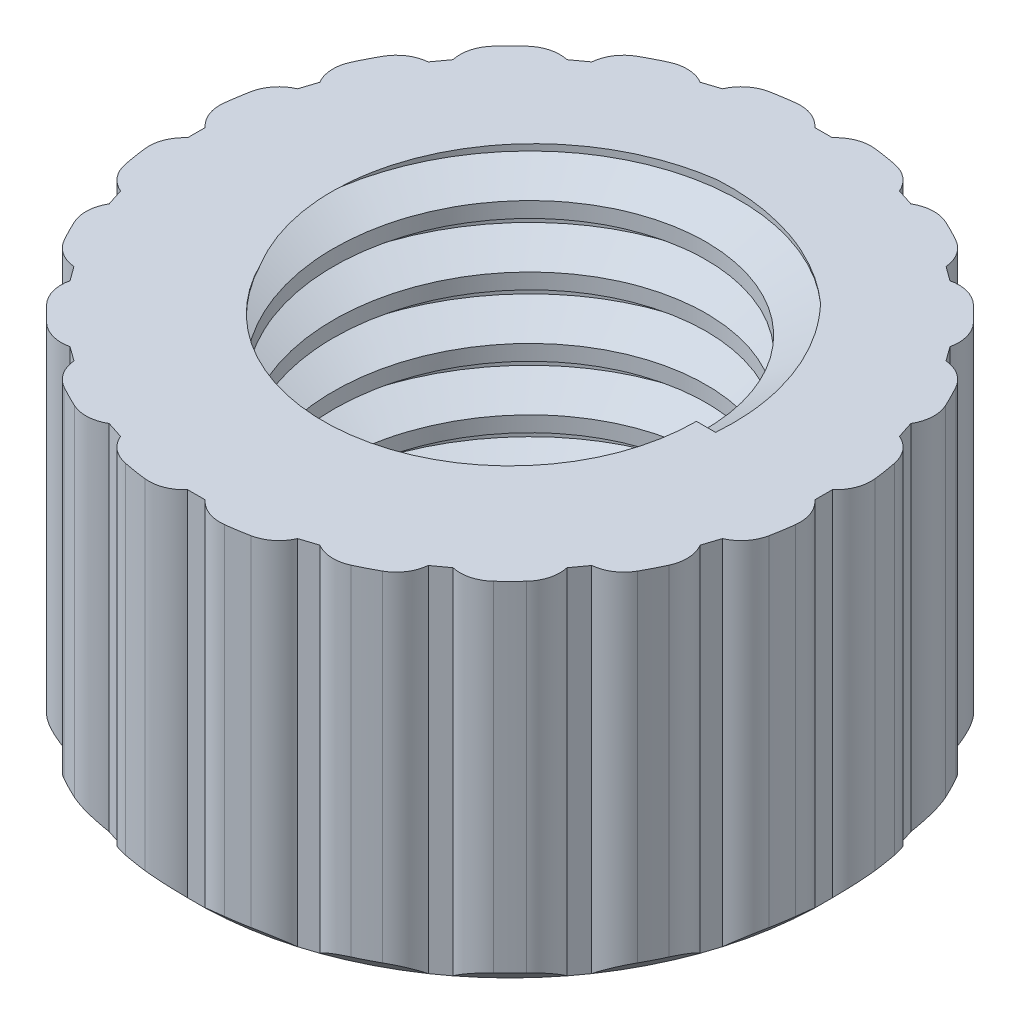
from build123d import *

# Parameters (mm, degrees)
CROQUIS2_R            = 2.5
CORTAR_EXTRUIR1_DEPTH = 10
ROSCA1_PITCH          = 1.75
CHAFL_N1_SIZE         = 0.4
CROQUIS7_W            = 0.8071572
CROQUIS7_H            = 0.5
CORTAR_EXTRUIR2_DEPTH = 17.493976346
REDONDEO1_R           = 1
MATRIZC2_START        = -8
MATRIZC2_DEPTH        = 10


# Read off the part's stored shape, not the designer's step: MatrizC2
with BuildPart() as part:
    # Croquis1 → Revolución1 (revolve)
    with BuildSketch(Plane.XY, mode=Mode.PRIVATE) as revoluci_n1_sk:
        Polygon((0, 0), (5.275, 0), (5.275, -8), (9.275, -8), (9.275, 2), (0, 2), align=None)
    revolve(revoluci_n1_sk.sketch.rotate(Axis((0, 0, 0), (0, -1, 0)), 90), axis=Axis((0, 0, 0), (0, -1, 0)))

    # Croquis2 → Cortar-Extruir1 (cut)
    with BuildSketch(Plane(origin=(0, 2, 0), x_dir=(1, 0, 0), z_dir=(0, 1, 0))):
        with Locations(Location((0, 0, 0), (0, 0, 270))):
            Circle(CROQUIS2_R)
    extrude(amount=-CORTAR_EXTRUIR1_DEPTH, mode=Mode.SUBTRACT)

    # Rosca1: the profile of Perfil de rosca1 profile screwed along a right-hand helix of 5.142857 turns, 10 arcs to a turn; built about Z, then put on its axis
    rosca1_z = Axis((0, 0, 0), (0, 0, 1))
    rosca1_corners = [(5.2747, 0, -0.000173205), (6.222215281, 0, 0.546874998), (6.222215281, 0, 0.765624998), (5.2747, 0, 1.3126732)]
    with BuildLine(mode=Mode.PRIVATE) as rosca1_profile:
        Line(rosca1_corners[0], rosca1_corners[1])
        Line(rosca1_corners[1], rosca1_corners[2])
        Line(rosca1_corners[2], rosca1_corners[3])
        Line(rosca1_corners[3], rosca1_corners[0])
    rosca1_cap = Face(rosca1_profile.wire())
    rosca1_turn_angles = [0, 18, 36, 54, 72, 90, 108, 126, 144, 162, 180, 198, 216, 234, 252, 270, 288, 306, 324, 342, 360]
    rosca1_turn_weights = [1, 0.9510565162951535, 1, 0.9510565162951535, 1, 0.9510565162951535, 1, 0.9510565162951535, 1, 0.9510565162951535, 1, 0.9510565162951535, 1, 0.9510565162951535, 1, 0.9510565162951535, 1, 0.9510565162951535, 1, 0.9510565162951535, 1]
    rosca1_turn_rails = [Edge.make_bspline([Vector(p[0], p[1], 0).rotate(rosca1_z, rosca1_turn_angles[k]) / rosca1_turn_weights[k] + Vector(0, 0, p[2] + ROSCA1_PITCH * rosca1_turn_angles[k] / 360) for k in range(21)], [0, 0, 0, 1, 1, 2, 2, 3, 3, 4, 4, 5, 5, 6, 6, 7, 7, 8, 8, 9, 9, 10, 10, 10], 2, rosca1_turn_weights) for p in rosca1_corners]
    rosca1_turn_sides = [Face.make_surface_from_curves(rosca1_turn_rails[p[0]], rosca1_turn_rails[p[1]]) for p in [(0, 1), (1, 2), (2, 3), (3, 0)]]
    rosca1_last_angles = [1800, 1818, 1836, 1843.714285714, 1851.428571429]
    rosca1_last_weights = [1, 0.9510565162951535, 1, 0.9909497617679349, 1]
    rosca1_last_rails = [Edge.make_bspline([Vector(p[0], p[1], 0).rotate(rosca1_z, rosca1_last_angles[k]) / rosca1_last_weights[k] + Vector(0, 0, p[2] + ROSCA1_PITCH * rosca1_last_angles[k] / 360) for k in range(5)], [0, 0, 0, 1, 1, 2, 2, 2], 2, rosca1_last_weights) for p in rosca1_corners]
    rosca1_last_sides = [Face.make_surface_from_curves(rosca1_last_rails[p[0]], rosca1_last_rails[p[1]]) for p in [(0, 1), (1, 2), (2, 3), (3, 0)]]
    rosca1 = Plane(origin=(0, -9, 0), x_dir=(1, 0, 0), z_dir=(0, 1, 0)) * Solid(Shell([*[p.moved(Location((0, 0, ROSCA1_PITCH * i))) for i in range(5) for p in rosca1_turn_sides], *rosca1_last_sides, rosca1_cap, rosca1_cap.rotate(rosca1_z, 1851.428571429).moved(Location((0, 0, ROSCA1_PITCH * 1851.428571429 / 360)))]))
    add(rosca1, mode=Mode.SUBTRACT)

    # Chaflán1
    chafl_n1_edges = [part.edges().sort_by_distance(p)[0] for p in [
        (0, 2, -2.5),
        (0, 2, -9.275),
    ]]
    chamfer(chafl_n1_edges, length=CHAFL_N1_SIZE)

    # Croquis7 → Cortar-Extruir2 (cut, symmetric)
    with BuildSketch(Plane(origin=(0, 2, 0), x_dir=(1, 0, 0), z_dir=(0, 1, 0))):
        with Locations((9.275, 0)):
            Rectangle(CROQUIS7_W, CROQUIS7_H)
    extrude(amount=CORTAR_EXTRUIR2_DEPTH, both=True, mode=Mode.SUBTRACT)

    # Redondeo1
    # the kernel refuses this fillet: 1 mm, written as the material it takes off along each edge
    with BuildSketch(Plane(origin=(9.271630116, -10.192865276, -0.25), x_dir=(-1, 0, 0), z_dir=(0, 1, 0))) as redondeo1_piece_1:
        with BuildLine():
            CenterArc((1.057697757, -0.753464107), REDONDEO1_R, 131.108652801, 55.856435853)
            Line((0.065077533, -0.874728652), (0.045225128, -0.877153943))
            ThreePointArc((0.045225128, -0.877153943), (0.002247604, -0.439617909), (-0.019992733, -0.000539084))
            Line((-0.019992733, -0.000539084), (0, 0.02))
            ThreePointArc((0, 0.02), (0.200104358, 0.02), (0.387058935, 0.015069282))
            Line((0.387058935, 0.015069282), (0.400208716, 0))
        make_face()
    extrude(amount=13.985730553, mode=Mode.SUBTRACT)
    with BuildSketch(Plane(origin=(9.271630116, -10.192865276, 0.25), x_dir=(-1, 0, 0), z_dir=(0, 1, 0))) as redondeo1_piece_2:
        with BuildLine():
            CenterArc((1.057697757, 0.753464107), REDONDEO1_R, 173.034911346, 55.856435853)
            Line((0.065077533, 0.874728652), (0.045225128, 0.877153943))
            ThreePointArc((0.045225128, 0.877153943), (0.002247604, 0.439617909), (-0.019992733, 0.000539084))
            Line((-0.019992733, 0.000539084), (0, -0.02))
            ThreePointArc((0, -0.02), (0.200104358, -0.02), (0.387058935, -0.015069282))
            Line((0.387058935, -0.015069282), (0.400208716, 0))
        make_face()
    extrude(amount=13.985730553, mode=Mode.SUBTRACT)

    # MatrizC2 outline → MatrizC2 (cut)
    with BuildSketch(Plane(origin=(0, 0, 0), x_dir=(1, 0, 0), z_dir=(0, 1, 0)).offset(MATRIZC2_START)):
        with BuildLine():
            ThreePointArc((8.408391559, 3.914661721), (8.500489438, 3.440902456), (8.359968882, 2.979184106))
            Line((8.359968882, 2.979184106), (8.514477379, 2.503655848))
            ThreePointArc((8.514477379, 2.503655848), (8.899552134, 2.212713767), (9.103512094, 1.775300694))
            ThreePointArc((9.103512094, 1.775300694), (8.821049189, 2.866132623), (8.408391559, 3.914661721))
        make_face()
        with BuildLine():
            ThreePointArc((8.359968882, -2.979184106), (8.500489438, -3.440902456), (8.408391559, -3.914661721))
            ThreePointArc((8.408391559, -3.914661721), (8.821049189, -2.866132623), (9.103512094, -1.775300694))
            ThreePointArc((9.103512094, -1.775300694), (8.899552134, -2.212713767), (8.514477379, -2.503655848))
            Line((8.514477379, -2.503655848), (8.359968882, -2.979184106))
        make_face()
        with BuildLine():
            ThreePointArc((7.030184363, -5.416744914), (7.021148537, -5.899288399), (6.787158585, -6.321400426))
            ThreePointArc((6.787158585, -6.321400426), (7.503632623, -5.451708215), (8.109356414, -4.501551239))
            ThreePointArc((8.109356414, -4.501551239), (7.780210892, -4.854528698), (7.32407699, -5.012236417))
            Line((7.32407699, -5.012236417), (7.030184363, -5.416744914))
        make_face()
        with BuildLine():
            ThreePointArc((5.012236417, -7.32407699), (4.854528698, -7.780210892), (4.501551239, -8.109356413))
            ThreePointArc((4.501551239, -8.109356413), (5.451708215, -7.503632623), (6.321400426, -6.787158585))
            ThreePointArc((6.321400426, -6.787158585), (5.899288399, -7.021148537), (5.416744914, -7.030184363))
            Line((5.416744914, -7.030184363), (5.012236417, -7.32407699))
        make_face()
        with BuildLine():
            ThreePointArc((2.503655848, -8.514477379), (2.212713767, -8.899552134), (1.775300694, -9.103512094))
            ThreePointArc((1.775300694, -9.103512094), (2.866132623, -8.821049189), (3.914661721, -8.408391559))
            ThreePointArc((3.914661721, -8.408391559), (3.440902456, -8.500489438), (2.979184106, -8.359968882))
            Line((2.979184106, -8.359968882), (2.503655848, -8.514477379))
        make_face()
        with BuildLine():
            ThreePointArc((-0.25, -8.8714214), (-0.645697005, -9.147743207), (-1.124728652, -9.206552583))
            ThreePointArc((-1.124728652, -9.206552583), (0, -9.275), (1.124728652, -9.206552583))
            ThreePointArc((1.124728652, -9.206552583), (0.645697005, -9.147743207), (0.25, -8.8714214))
            Line((0.25, -8.8714214), (-0.25, -8.8714214))
        make_face()
        with BuildLine():
            ThreePointArc((-2.979184106, -8.359968882), (-3.440902456, -8.500489438), (-3.914661721, -8.408391559))
            ThreePointArc((-3.914661721, -8.408391559), (-2.866132623, -8.821049189), (-1.775300694, -9.103512094))
            ThreePointArc((-1.775300694, -9.103512094), (-2.212713767, -8.899552134), (-2.503655848, -8.514477379))
            Line((-2.503655848, -8.514477379), (-2.979184106, -8.359968882))
        make_face()
        with BuildLine():
            ThreePointArc((-5.416744914, -7.030184363), (-5.899288399, -7.021148537), (-6.321400426, -6.787158585))
            ThreePointArc((-6.321400426, -6.787158585), (-5.451708215, -7.503632623), (-4.501551239, -8.109356414))
            ThreePointArc((-4.501551239, -8.109356414), (-4.854528698, -7.780210892), (-5.012236417, -7.32407699))
            Line((-5.012236417, -7.32407699), (-5.416744914, -7.030184363))
        make_face()
        with BuildLine():
            ThreePointArc((-7.32407699, -5.012236417), (-7.780210892, -4.854528698), (-8.109356413, -4.501551239))
            ThreePointArc((-8.109356413, -4.501551239), (-7.503632623, -5.451708215), (-6.787158585, -6.321400426))
            ThreePointArc((-6.787158585, -6.321400426), (-7.021148537, -5.899288399), (-7.030184363, -5.416744914))
            Line((-7.030184363, -5.416744914), (-7.32407699, -5.012236417))
        make_face()
        with BuildLine():
            ThreePointArc((-8.514477379, -2.503655848), (-8.899552134, -2.212713767), (-9.103512094, -1.775300694))
            ThreePointArc((-9.103512094, -1.775300694), (-8.821049189, -2.866132623), (-8.408391559, -3.914661721))
            ThreePointArc((-8.408391559, -3.914661721), (-8.500489438, -3.440902456), (-8.359968882, -2.979184106))
            Line((-8.359968882, -2.979184106), (-8.514477379, -2.503655848))
        make_face()
        with BuildLine():
            ThreePointArc((-8.8714214, 0.25), (-9.147743207, 0.645697005), (-9.206552583, 1.124728652))
            ThreePointArc((-9.206552583, 1.124728652), (-9.275, 0), (-9.206552583, -1.124728652))
            ThreePointArc((-9.206552583, -1.124728652), (-9.147743207, -0.645697005), (-8.8714214, -0.25))
            Line((-8.8714214, -0.25), (-8.8714214, 0.25))
        make_face()
        with BuildLine():
            ThreePointArc((-8.359968882, 2.979184106), (-8.500489438, 3.440902456), (-8.408391559, 3.914661721))
            ThreePointArc((-8.408391559, 3.914661721), (-8.821049189, 2.866132623), (-9.103512094, 1.775300694))
            ThreePointArc((-9.103512094, 1.775300694), (-8.899552134, 2.212713767), (-8.514477379, 2.503655848))
            Line((-8.514477379, 2.503655848), (-8.359968882, 2.979184106))
        make_face()
        with BuildLine():
            ThreePointArc((-7.030184363, 5.416744914), (-7.021148537, 5.899288399), (-6.787158585, 6.321400426))
            ThreePointArc((-6.787158585, 6.321400426), (-7.503632623, 5.451708215), (-8.109356413, 4.501551239))
            ThreePointArc((-8.109356413, 4.501551239), (-7.780210892, 4.854528698), (-7.32407699, 5.012236417))
            Line((-7.32407699, 5.012236417), (-7.030184363, 5.416744914))
        make_face()
        with BuildLine():
            ThreePointArc((-5.012236417, 7.32407699), (-4.854528698, 7.780210892), (-4.501551239, 8.109356413))
            ThreePointArc((-4.501551239, 8.109356413), (-5.451708215, 7.503632623), (-6.321400426, 6.787158585))
            ThreePointArc((-6.321400426, 6.787158585), (-5.899288399, 7.021148537), (-5.416744914, 7.030184363))
            Line((-5.416744914, 7.030184363), (-5.012236417, 7.32407699))
        make_face()
        with BuildLine():
            ThreePointArc((-2.503655848, 8.514477379), (-2.212713767, 8.899552134), (-1.775300694, 9.103512094))
            ThreePointArc((-1.775300694, 9.103512094), (-2.866132623, 8.821049189), (-3.914661721, 8.408391559))
            ThreePointArc((-3.914661721, 8.408391559), (-3.440902456, 8.500489438), (-2.979184106, 8.359968882))
            Line((-2.979184106, 8.359968882), (-2.503655848, 8.514477379))
        make_face()
        with BuildLine():
            ThreePointArc((0.25, 8.8714214), (0.645697005, 9.147743207), (1.124728652, 9.206552583))
            ThreePointArc((1.124728652, 9.206552583), (0, 9.275), (-1.124728652, 9.206552583))
            ThreePointArc((-1.124728652, 9.206552583), (-0.645697005, 9.147743207), (-0.25, 8.8714214))
            Line((-0.25, 8.8714214), (0.25, 8.8714214))
        make_face()
        with BuildLine():
            ThreePointArc((2.979184106, 8.359968882), (3.440902456, 8.500489438), (3.914661721, 8.408391559))
            ThreePointArc((3.914661721, 8.408391559), (2.866132623, 8.821049189), (1.775300694, 9.103512094))
            ThreePointArc((1.775300694, 9.103512094), (2.212713767, 8.899552134), (2.503655848, 8.514477379))
            Line((2.503655848, 8.514477379), (2.979184106, 8.359968882))
        make_face()
        with BuildLine():
            ThreePointArc((5.416744914, 7.030184363), (5.899288399, 7.021148537), (6.321400426, 6.787158585))
            ThreePointArc((6.321400426, 6.787158585), (5.451708215, 7.503632623), (4.501551239, 8.109356414))
            ThreePointArc((4.501551239, 8.109356414), (4.854528698, 7.780210892), (5.012236417, 7.32407699))
            Line((5.012236417, 7.32407699), (5.416744914, 7.030184363))
        make_face()
        with BuildLine():
            ThreePointArc((7.32407699, 5.012236417), (7.780210892, 4.854528698), (8.109356413, 4.501551239))
            ThreePointArc((8.109356413, 4.501551239), (7.503632623, 5.451708215), (6.787158585, 6.321400426))
            ThreePointArc((6.787158585, 6.321400426), (7.021148537, 5.899288399), (7.030184363, 5.416744914))
            Line((7.030184363, 5.416744914), (7.32407699, 5.012236417))
        make_face()
    extrude(amount=MATRIZC2_DEPTH, mode=Mode.SUBTRACT)


with BuildPart() as body_2:
    # Simetría3: mirrored copy
    add(part.part.mirror(Plane(origin=(9.275, 2, 0), x_dir=(0, 0, 1), z_dir=(0, -1, 0))))


solid = body_2.part
